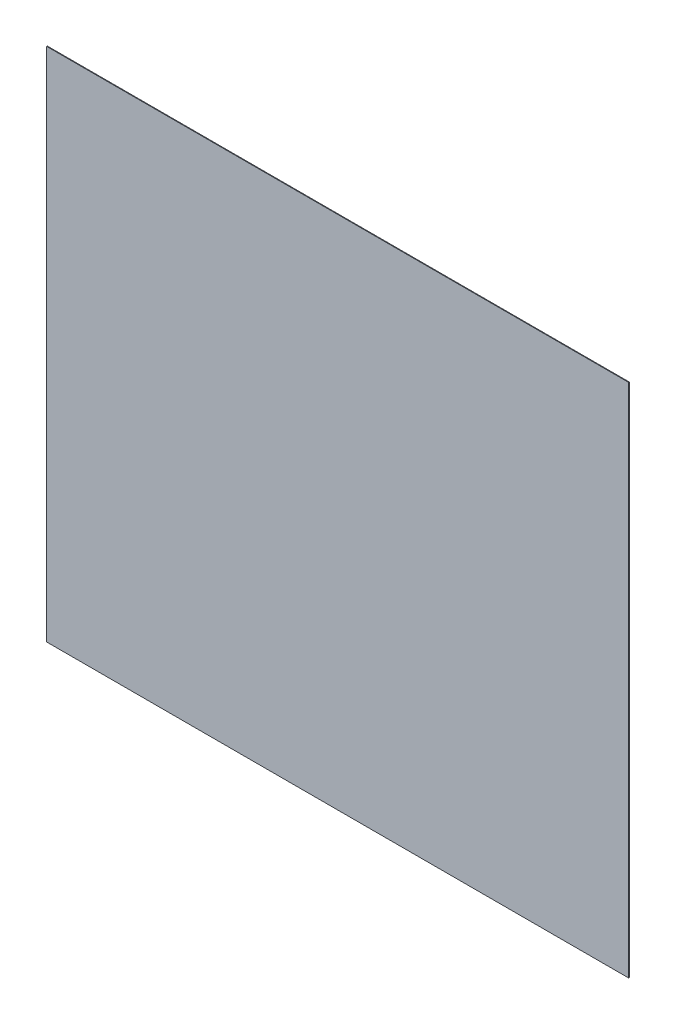
from build123d import *

# Parameters (mm, degrees)
CROQUIS1_W        = 1412
CROQUIS1_H        = 1251.5
BRIDA_BASE1_DEPTH = 1.5875


# Sheet-metal steps are written as plain solids
with BuildPart() as part:
    # Croquis1 → Brida base1 (new body)
    with BuildSketch(Plane.XY):
        Rectangle(CROQUIS1_W, CROQUIS1_H)
    extrude(amount=-BRIDA_BASE1_DEPTH)


solid = part.part
